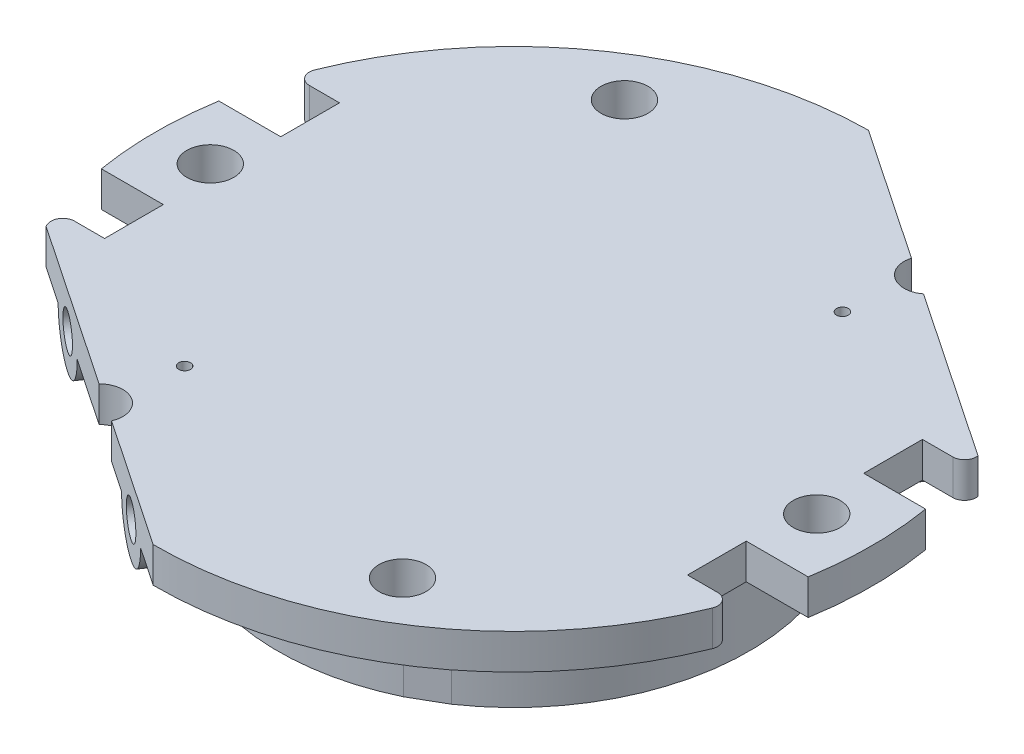
from build123d import *

# Parameters (mm, degrees)
CROQUIS1_R              = 30.5
SALIENTE_EXTRUIR1_DEPTH = 3
CORTAR_EXTRUIR3_START   = -4
CORTAR_EXTRUIR3_DEPTH   = 4
CORTAR_EXTRUIR4_DEPTH   = 10
CROQUIS8_R              = 0.5
CORTAR_EXTRUIR5_DEPTH   = 3
SALIENTE_EXTRUIR2_DEPTH = 13
CROQUIS11_W             = 34.583232932
CROQUIS11_H             = 3
SALIENTE_EXTRUIR3_DEPTH = 6
CROQUIS12_R             = 2
CORTAR_EXTRUIR7_DEPTH   = 3
SALIENTE_EXTRUIR4_DEPTH = 20
CROQUIS14_R             = 1.5
CORTAR_EXTRUIR8_DEPTH   = 6
CORTAR_EXTRUIR9_START   = -3
CORTAR_EXTRUIR9_DEPTH   = 3
CROQUIS16_W             = 33.68877148
CROQUIS16_H             = 3
SALIENTE_EXTRUIR5_DEPTH = 6
CROQUIS17_R             = 2
CORTAR_EXTRUIR10_DEPTH  = 3
CROQUIS18_R             = 3
SALIENTE_EXTRUIR6_DEPTH = 25
CROQUIS19_R             = 1.5
CORTAR_EXTRUIR11_DEPTH  = 5
CORTAR_EXTRUIR12_DEPTH  = 6
CORTAR_EXTRUIR13_DEPTH  = 6
CROQUIS22_R             = 1.5
CORTAR_EXTRUIR14_DEPTH  = 6
CROQUIS23_R             = 1.5
CORTAR_EXTRUIR15_DEPTH  = 6
REDONDEO1_R             = 1


with BuildPart() as part:
    # Croquis1 → Saliente-Extruir1 (new body)
    with BuildSketch(Plane(origin=(0, 0, 0), x_dir=(1, 0, 0), z_dir=(0, 1, 0))):
        with Locations(Location((0, 0, 0), (0, 0, 270))):
            Circle(CROQUIS1_R)
    extrude(amount=SALIENTE_EXTRUIR1_DEPTH)

    # Croquis5 → Cortar-Extruir3 (cut)
    with BuildSketch(Plane(origin=(0, 3, 0), x_dir=(1, 0, 0), z_dir=(0, 1, 0)).offset(CORTAR_EXTRUIR3_START)):
        with BuildLine():
            ThreePointArc((-30.087372767, -5), (-29.556634924, -7.526973624), (-28.814059068, -10))
            Line((-28.814059068, -10), (-24.814059068, -10))
            Line((-24.814059068, -10), (-24.814059068, -5))
            Line((-24.814059068, -5), (-28.814059068, -5))
            Line((-28.814059068, -5), (-30.087372767, -5))
        make_face()
        with BuildLine():
            ThreePointArc((-28.814059068, 10), (-29.556634924, 7.526973624), (-30.087372767, 5))
            Line((-30.087372767, 5), (-28.814059068, 5))
            Line((-28.814059068, 5), (-24.814059068, 5))
            Line((-24.814059068, 5), (-24.814059068, 10))
            Line((-24.814059068, 10), (-28.814059068, 10))
        make_face()
        with BuildLine():
            Line((28.814059068, 5), (30.087372767, 5))
            ThreePointArc((30.087372767, 5), (29.556634924, 7.526973624), (28.814059068, 10))
            Line((28.814059068, 10), (24.814059068, 10))
            Line((24.814059068, 10), (24.814059068, 5))
            Line((24.814059068, 5), (28.814059068, 5))
        make_face()
        with BuildLine():
            Line((30.087372767, -5), (28.814059068, -5))
            Line((28.814059068, -5), (24.814059068, -5))
            Line((24.814059068, -5), (24.814059068, -10))
            Line((24.814059068, -10), (28.814059068, -10))
            ThreePointArc((28.814059068, -10), (29.556634924, -7.526973624), (30.087372767, -5))
        make_face()
    extrude(amount=CORTAR_EXTRUIR3_DEPTH, mode=Mode.SUBTRACT)

    # Croquis7 → Cortar-Extruir4 (cut)
    with BuildSketch(Plane(origin=(0, 3, 0), x_dir=(1, 0, 0), z_dir=(0, 1, 0))):
        with BuildLine():
            ThreePointArc((-13.907029535, 20.623580122), (-11.907029535, 20.623580122), (-10.907029535, 22.355630929))
            Line((-10.907029535, 22.355630929), (-12.907029535, 22.355630929))
            Line((-12.907029535, 22.355630929), (-13.907029535, 20.623580122))
        make_face()
        with BuildLine():
            Line((-12.907029535, 22.355630929), (-10.907029535, 22.355630929))
            ThreePointArc((-10.907029535, 22.355630929), (-13.907029535, 24.087681737), (-13.907029535, 20.623580122))
            Line((-13.907029535, 20.623580122), (-12.907029535, 22.355630929))
        make_face()
        with BuildLine():
            ThreePointArc((-23.81405907, 0), (-24.082008262, 1), (-24.81405907, 1.732050808))
            Line((-24.81405907, 1.732050808), (-25.81405907, 0))
            Line((-25.81405907, 0), (-24.81405907, -1.732050808))
            ThreePointArc((-24.81405907, -1.732050808), (-24.082008262, -1), (-23.81405907, 0))
        make_face()
        with BuildLine():
            Line((-25.81405907, 0), (-24.81405907, 1.732050808))
            ThreePointArc((-24.81405907, 1.732050808), (-27.81405907, 0), (-24.81405907, -1.732050808))
            Line((-24.81405907, -1.732050808), (-25.81405907, 0))
        make_face()
        with BuildLine():
            ThreePointArc((10.907029535, 22.355630929), (11.907029535, 20.623580122), (13.907029535, 20.623580122))
            Line((13.907029535, 20.623580122), (12.907029535, 22.355630929))
            Line((12.907029535, 22.355630929), (10.907029535, 22.355630929))
        make_face()
        with BuildLine():
            Line((12.907029535, 22.355630929), (13.907029535, 20.623580122))
            ThreePointArc((13.907029535, 20.623580122), (14.639080343, 21.355630929), (14.907029535, 22.355630929))
            ThreePointArc((14.907029535, 22.355630929), (12.907029535, 24.355630929), (10.907029535, 22.355630929))
            Line((10.907029535, 22.355630929), (12.907029535, 22.355630929))
        make_face()
        with BuildLine():
            Line((24.81405907, -1.732050808), (25.81405907, 0))
            Line((25.81405907, 0), (24.81405907, 1.732050808))
            ThreePointArc((24.81405907, 1.732050808), (23.81405907, 0), (24.81405907, -1.732050808))
        make_face()
        with BuildLine():
            Line((24.81405907, 1.732050808), (25.81405907, 0))
            Line((25.81405907, 0), (24.81405907, -1.732050808))
            ThreePointArc((24.81405907, -1.732050808), (26.81405907, -1.732050808), (27.81405907, 0))
            ThreePointArc((27.81405907, 0), (26.81405907, 1.732050808), (24.81405907, 1.732050808))
        make_face()
        with BuildLine():
            ThreePointArc((-13.907029535, -20.623580122), (-13.907029535, -24.087681737), (-10.907029535, -22.355630929))
            Line((-10.907029535, -22.355630929), (-12.907029535, -22.355630929))
            Line((-12.907029535, -22.355630929), (-13.907029535, -20.623580122))
        make_face()
        with BuildLine():
            Line((-12.907029535, -22.355630929), (-10.907029535, -22.355630929))
            ThreePointArc((-10.907029535, -22.355630929), (-11.907029535, -20.623580122), (-13.907029535, -20.623580122))
            Line((-13.907029535, -20.623580122), (-12.907029535, -22.355630929))
        make_face()
        with BuildLine():
            ThreePointArc((14.907029535, -22.355630929), (14.639080343, -21.355630929), (13.907029535, -20.623580122))
            Line((13.907029535, -20.623580122), (12.907029535, -22.355630929))
            Line((12.907029535, -22.355630929), (10.907029535, -22.355630929))
            ThreePointArc((10.907029535, -22.355630929), (12.907029535, -24.355630929), (14.907029535, -22.355630929))
        make_face()
        with BuildLine():
            Line((12.907029535, -22.355630929), (13.907029535, -20.623580122))
            ThreePointArc((13.907029535, -20.623580122), (11.907029535, -20.623580122), (10.907029535, -22.355630929))
            Line((10.907029535, -22.355630929), (12.907029535, -22.355630929))
        make_face()
    extrude(amount=-CORTAR_EXTRUIR4_DEPTH, mode=Mode.SUBTRACT)

    # Croquis8 → Cortar-Extruir5 (cut)
    with BuildSketch(Plane(origin=(0, 3, 0), x_dir=(1, 0, 0), z_dir=(0, 1, 0))):
        with Locations(Location((12, 16, 0), (0, 0, 270))):
            Circle(CROQUIS8_R)
        with Locations(Location((-12, -16, 0), (0, 0, 270))):
            Circle(CROQUIS8_R)
    extrude(amount=-CORTAR_EXTRUIR5_DEPTH, mode=Mode.SUBTRACT)

    # Croquis9 → Saliente-Extruir2 (add)
    with BuildSketch(Plane(origin=(0, 3, 0), x_dir=(1, 0, 0), z_dir=(0, 1, 0))):
        with BuildLine():
            Line((-8.700961894, 18.070508076), (-10, 17.320508076))
            Line((-10, 17.320508076), (-11.299038106, 16.570508076))
            ThreePointArc((-11.299038106, 16.570508076), (-19.960969499, 1.951844427), (-14.294950117, -14.067849912))
            ThreePointArc((-14.294950117, -14.067849912), (-10.97161543, -13.181769141), (-9, -16))
            ThreePointArc((-9, -16), (-9.12838457, -16.868230859), (-9.502549883, -17.662150088))
            ThreePointArc((-9.502549883, -17.662150088), (-0.449805389, -20.05112653), (8.700961894, -18.070508076))
            Line((8.700961894, -18.070508076), (10, -17.320508076))
            Line((10, -17.320508076), (11.299038106, -16.570508076))
            ThreePointArc((11.299038106, -16.570508076), (17.732250869, -9.371087404), (20.05617112, 0))
            ThreePointArc((20.05617112, 0), (18.560064193, 7.600922125), (14.294950117, 14.067849912))
            ThreePointArc((14.294950117, 14.067849912), (10.2, 13.6), (9.502549883, 17.662150088))
            ThreePointArc((9.502549883, 17.662150088), (0.449805389, 20.05112653), (-8.700961894, 18.070508076))
        make_face()
    extrude(amount=-SALIENTE_EXTRUIR2_DEPTH)

    # Croquis11 → Saliente-Extruir3 (add)
    with BuildSketch(Plane(origin=(14.04954782, 0, -20.829311224), x_dir=(-0.8290375725550414, 0, -0.5591929034707472), z_dir=(0.5591929034707472, 0, -0.8290375725550414))):
        with Locations((0, 1.5)):
            Rectangle(CROQUIS11_W, CROQUIS11_H)
    extrude(amount=SALIENTE_EXTRUIR3_DEPTH)

    # Croquis12 → Cortar-Extruir7 (cut)
    with BuildSketch(Plane(origin=(0, 3, 0), x_dir=(1, 0, 0), z_dir=(0, 1, 0))):
        with Locations(Location((12.907029535, 22.355630929, 0), (0, 0, 270))):
            Circle(CROQUIS12_R)
    extrude(amount=-CORTAR_EXTRUIR7_DEPTH, mode=Mode.SUBTRACT)

    # Croquis13 → Saliente-Extruir4 (add)
    with BuildSketch(Plane(origin=(17.404705241, 0, -25.803536659), x_dir=(-0.8290375725550414, 0, -0.5591929034707472), z_dir=(0.5591929034707472, 0, -0.8290375725550414))):
        with BuildLine():
            ThreePointArc((10, 3), (7.878679656, 2.121320344), (7, 0))
            Line((7, 0), (8.5, 0))
            ThreePointArc((8.5, 0), (10, 1.5), (11.5, 0))
            Line((11.5, 0), (13, 0))
            ThreePointArc((13, 0), (12.121320344, 2.121320344), (10, 3))
        make_face()
        with BuildLine():
            Line((8.5, 0), (7, 0))
            ThreePointArc((7, 0), (10, -3), (13, 0))
            Line((13, 0), (11.5, 0))
            ThreePointArc((11.5, 0), (10, -1.5), (8.5, 0))
        make_face()
        with BuildLine():
            ThreePointArc((-11.5, 0), (-10, 1.5), (-8.5, 0))
            Line((-8.5, 0), (-7, 0))
            ThreePointArc((-7, 0), (-7.878679656, 2.121320343), (-9.999999999, 3))
            ThreePointArc((-9.999999999, 3), (-12.121320343, 2.121320344), (-13, 0))
            Line((-13, 0), (-11.5, 0))
        make_face()
        with BuildLine():
            Line((-7, 0), (-8.5, 0))
            ThreePointArc((-8.5, 0), (-10, -1.5), (-11.5, 0))
            Line((-11.5, 0), (-13, 0))
            ThreePointArc((-13, 0), (-10, -3), (-7, 0))
        make_face()
        with BuildLine():
            ThreePointArc((-11.5, 0), (-10, -1.5), (-8.5, 0))
            Line((-8.5, 0), (-11.5, 0))
        make_face()
        with BuildLine():
            Line((-11.5, 0), (-8.5, 0))
            ThreePointArc((-8.5, 0), (-10, 1.5), (-11.5, 0))
        make_face()
        with BuildLine():
            ThreePointArc((11.5, 0), (10, 1.5), (8.5, 0))
            Line((8.5, 0), (11.5, 0))
        make_face()
        with BuildLine():
            Line((11.5, 0), (8.5, 0))
            ThreePointArc((8.5, 0), (10, -1.5), (11.5, 0))
        make_face()
    extrude(amount=-SALIENTE_EXTRUIR4_DEPTH)

    # Croquis14 → Cortar-Extruir8 (cut)
    with BuildSketch(Plane(origin=(17.404705241, 0, -25.803536659), x_dir=(-0.8290375725550414, 0, -0.5591929034707472), z_dir=(0.5591929034707472, 0, -0.8290375725550414))):
        with Locations((-10, 0)):
            Circle(CROQUIS14_R)
        with Locations((10, 0)):
            Circle(CROQUIS14_R)
    extrude(amount=-CORTAR_EXTRUIR8_DEPTH, mode=Mode.SUBTRACT)

    # Croquis15 → Cortar-Extruir9 (cut)
    with BuildSketch(Plane(origin=(0, 3, 0), x_dir=(1, 0, 0), z_dir=(0, 1, 0)).offset(CORTAR_EXTRUIR9_START)):
        with BuildLine():
            ThreePointArc((-28.212513648, -11.588963441), (-17.055383556, -25.285645963), (-0.176506165, -30.499489267))
            Line((-0.176506165, -30.499489267), (-11.071782568, -23.15053254))
            ThreePointArc((-11.071782568, -23.15053254), (-14.025415342, -24.013706075), (-14.331545089, -20.951794957))
            Line((-14.331545089, -20.951794957), (-28.212513648, -11.588963441))
        make_face()
    extrude(amount=CORTAR_EXTRUIR9_DEPTH, mode=Mode.SUBTRACT)

    # Croquis16 → Saliente-Extruir5 (add)
    with BuildSketch(Plane(origin=(-14.194509906, 0, 21.044226354), x_dir=(0.8290375725550415, 0, 0.5591929034707472), z_dir=(-0.5591929034707471, 0, 0.8290375725550414))):
        with Locations((-0.064381976, 1.5)):
            Rectangle(CROQUIS16_W, CROQUIS16_H)
    extrude(amount=SALIENTE_EXTRUIR5_DEPTH)

    # Croquis17 → Cortar-Extruir10 (cut)
    with BuildSketch(Plane(origin=(0, 3, 0), x_dir=(1, 0, 0), z_dir=(0, 1, 0))):
        with Locations(Location((-12.907029535, -22.355630929, 0), (0, 0, 270))):
            Circle(CROQUIS17_R)
    extrude(amount=-CORTAR_EXTRUIR10_DEPTH, mode=Mode.SUBTRACT)

    # Croquis18 → Saliente-Extruir6 (add)
    with BuildSketch(Plane(origin=(-17.549667327, 0, 26.01845179), x_dir=(0.8290375725550416, 0, 0.5591929034707471), z_dir=(-0.5591929034707471, 0, 0.8290375725550416))):
        with Locations((9.935618024, 0)):
            Circle(CROQUIS18_R)
        with Locations((-10.064381976, 0)):
            Circle(CROQUIS18_R)
    extrude(amount=-SALIENTE_EXTRUIR6_DEPTH)

    # Croquis19 → Cortar-Extruir11 (cut)
    with BuildSketch(Plane(origin=(-17.549667327, 0, 26.01845179), x_dir=(0.8290375725550416, 0, 0.5591929034707471), z_dir=(-0.5591929034707471, 0, 0.8290375725550416))):
        with Locations((-10.064381976, 0)):
            Circle(CROQUIS19_R)
        with Locations((9.935618024, 0)):
            Circle(CROQUIS19_R)
    extrude(amount=-CORTAR_EXTRUIR11_DEPTH, mode=Mode.SUBTRACT)

    # Croquis20 → Cortar-Extruir12 (cut)
    with BuildSketch(Plane(origin=(17.404705241, 0, -25.803536659), x_dir=(-0.8290375725550413, 0, -0.5591929034707475), z_dir=(0.5591929034707475, 0, -0.8290375725550414))):
        with BuildLine():
            Line((17.291616466, 3), (17.291616466, 0))
            Line((17.291616466, 0), (13, 0))
            ThreePointArc((13, 0), (10, -3), (7, 0))
            Line((7, 0), (-7, 0))
            ThreePointArc((-7, 0), (-10, -3), (-13, 0))
            Line((-13, 0), (-17.291616466, 0))
            Line((-17.291616466, 0), (-17.291616466, 3))
            Line((-17.291616466, 3), (17.291616466, 3))
        make_face()
    extrude(amount=-CORTAR_EXTRUIR12_DEPTH, mode=Mode.SUBTRACT)

    # Croquis21 → Cortar-Extruir13 (cut)
    with BuildSketch(Plane(origin=(-17.549667327, 0, 26.01845179), x_dir=(0.8290375725550416, 0, 0.5591929034707471), z_dir=(-0.5591929034707471, 0, 0.8290375725550416))):
        with BuildLine():
            Line((-13.064381976, 0), (-16.908767716, 0))
            Line((-16.908767716, 0), (-16.908767716, 3))
            Line((-16.908767716, 3), (16.780003764, 3))
            Line((16.780003764, 3), (16.780003764, 0))
            Line((16.780003764, 0), (12.935618024, 0))
            ThreePointArc((12.935618024, 0), (9.935618024, -3), (6.935618024, 0))
            Line((6.935618024, 0), (-7.064381976, 0))
            ThreePointArc((-7.064381976, 0), (-10.064381976, -3), (-13.064381976, 0))
        make_face()
    extrude(amount=-CORTAR_EXTRUIR13_DEPTH, mode=Mode.SUBTRACT)

    # Croquis22 → Cortar-Extruir14 (cut)
    with BuildSketch(Plane(origin=(-14.194509906, 0, 21.044226354), x_dir=(0.8290375725550415, 0, 0.5591929034707471), z_dir=(-0.5591929034707471, 0, 0.8290375725550415))):
        with Locations((-10.064381976, 0)):
            Circle(CROQUIS22_R)
        with Locations((9.935618024, 0)):
            Circle(CROQUIS22_R)
    extrude(amount=-CORTAR_EXTRUIR14_DEPTH, mode=Mode.SUBTRACT)

    # Croquis23 → Cortar-Extruir15 (cut)
    with BuildSketch(Plane(origin=(14.04954782, 0, -20.829311224), x_dir=(-0.8290375725550414, 0, -0.5591929034707472), z_dir=(0.5591929034707472, 0, -0.8290375725550414))):
        with Locations((-10, 0)):
            Circle(CROQUIS23_R)
        with Locations((10, 0)):
            Circle(CROQUIS23_R)
    extrude(amount=-CORTAR_EXTRUIR15_DEPTH, mode=Mode.SUBTRACT)

    # Redondeo1
    # the kernel refuses this fillet: 1 mm, written as the material it takes off along each edge
    with BuildSketch(Plane(origin=(-28.814059068, -3.664646039, 10), x_dir=(0.3504763124105457, 0, 0.9365715960027324), z_dir=(0, 1, 0))) as redondeo1_piece_1:
        with BuildLine():
            CenterArc((1.44182795, 0.999711227), REDONDEO1_R, 159.48354873, 111.893428089)
            Line((0.505256354, 1.350187539), (0.486524922, 1.357197065))
            Line((0.486524922, 1.357197065), (-0.018731432, 0.007009526))
            Line((-0.018731432, 0.007009526), (-0.000480609, -0.019994225))
            ThreePointArc((-0.000480609, -0.019994225), (0.732929208, -0.028807587), (1.466339025, -0.019994225))
            Line((1.466339025, -0.019994225), (1.465858416, 0))
        make_face()
    extrude(amount=10.329292079, mode=Mode.SUBTRACT)
    with BuildSketch(Plane(origin=(-28.814059068, -3.664646039, -10), x_dir=(1, 0, 0), z_dir=(0, 1, 0))) as redondeo1_piece_2:
        with BuildLine():
            CenterArc((1.441627682, 1), REDONDEO1_R, 158.106571911, 111.893428089)
            Line((0.513748652, 1.372881356), (0.495191071, 1.380338983))
            ThreePointArc((0.495191071, 1.380338983), (0.229893958, 0.696537055), (-0.018894465, 0.006557377))
            Line((-0.018894465, 0.006557377), (0, -0.02))
            Line((0, -0.02), (1.441627682, -0.02))
            Line((1.441627682, -0.02), (1.441627682, 0))
        make_face()
    extrude(amount=10.329292079, mode=Mode.SUBTRACT)
    with BuildSketch(Plane(origin=(28.814059068, -3.540586699, -10), x_dir=(-1, 0, 0), z_dir=(0, 1, 0))) as redondeo1_piece_3:
        with BuildLine():
            CenterArc((1.41623468, -1), REDONDEO1_R, 90, 99.20469094)
            Line((0.429111508, -1.159962006), (0.409369044, -1.163161246))
            ThreePointArc((0.409369044, -1.163161246), (0.189917894, -0.58909543), (-0.018894465, -0.006557377))
            Line((-0.018894465, -0.006557377), (0, 0.02))
            Line((0, 0.02), (1.41623468, 0.02))
            Line((1.41623468, 0.02), (1.41623468, 0))
        make_face()
    extrude(amount=10.081173399, mode=Mode.SUBTRACT)
    with BuildSketch(Plane(origin=(28.814059068, -3.664646039, 10), x_dir=(-0.35047631241054894, 0, 0.9365715960027313), z_dir=(0, 1, 0))) as redondeo1_piece_4:
        with BuildLine():
            CenterArc((1.44182795, -0.999711227), REDONDEO1_R, 88.623023181, 111.893428089)
            Line((0.505256354, -1.350187539), (0.486524922, -1.357197065))
            Line((0.486524922, -1.357197065), (-0.018731432, -0.007009526))
            Line((-0.018731432, -0.007009526), (-0.000480609, 0.019994225))
            ThreePointArc((-0.000480609, 0.019994225), (0.732929208, 0.028807587), (1.466339025, 0.019994225))
            Line((1.466339025, 0.019994225), (1.465858416, 0))
        make_face()
    extrude(amount=10.329292079, mode=Mode.SUBTRACT)


solid = part.part
